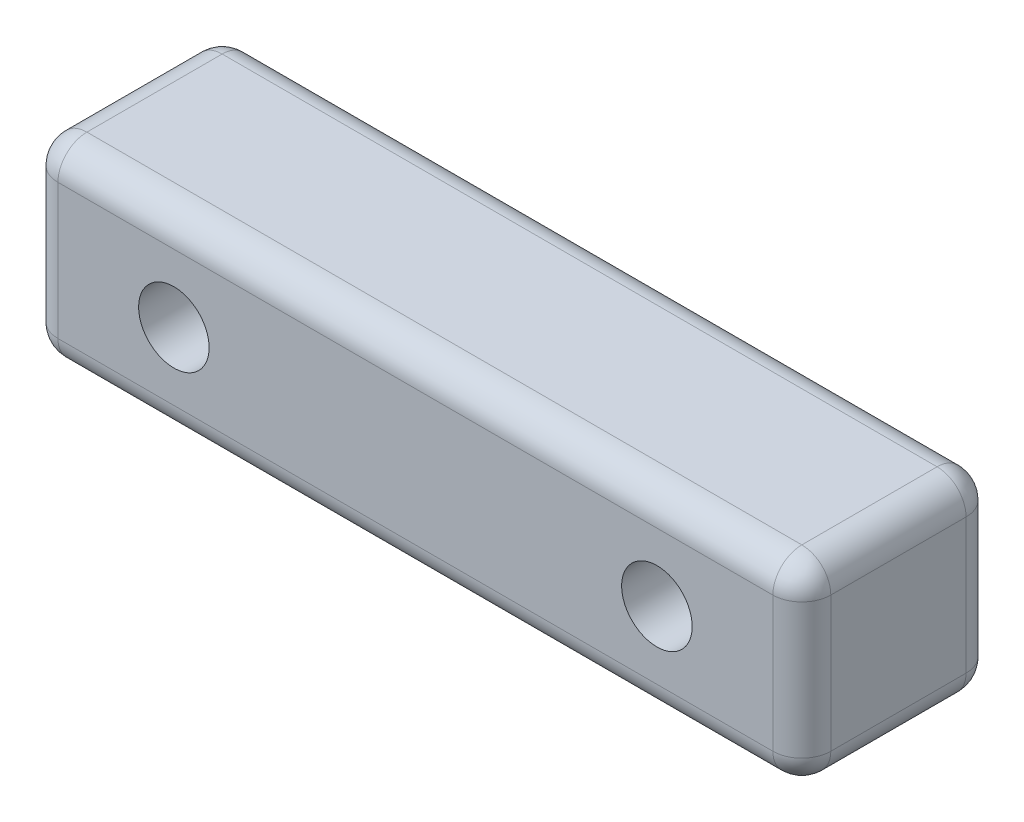
from build123d import *

# Parameters (mm, degrees)
CROQUIS1_W              = 80
CROQUIS1_H              = 20
CROQUIS1_R              = 3.65
SALIENTE_EXTRUIR1_DEPTH = 20
REDONDEO1_R             = 3


with BuildPart() as part:
    # Croquis1 → Saliente-Extruir1 (new body)
    with BuildSketch(Plane.XY):
        Rectangle(CROQUIS1_W, CROQUIS1_H)
        with Locations((25, 0)):
            Circle(CROQUIS1_R, mode=Mode.SUBTRACT)
        with Locations((-25, 0)):
            Circle(CROQUIS1_R, mode=Mode.SUBTRACT)
    extrude(amount=SALIENTE_EXTRUIR1_DEPTH)

    # Redondeo1
    redondeo1_edges = [part.edges().sort_by_distance(p)[0] for p in [
        (0, -10, 20),
        (-40, -10, 10),
        (-40, 0, 20),
        (0, 10, 20),
        (40, 0, 20),
        (40, -10, 10),
        (0, -10, 0),
        (-40, 0, 0),
        (-40, 10, 10),
        (40, 10, 10),
        (40, 0, 0),
        (0, 10, 0),
    ]]
    fillet(redondeo1_edges, radius=REDONDEO1_R)


solid = part.part
